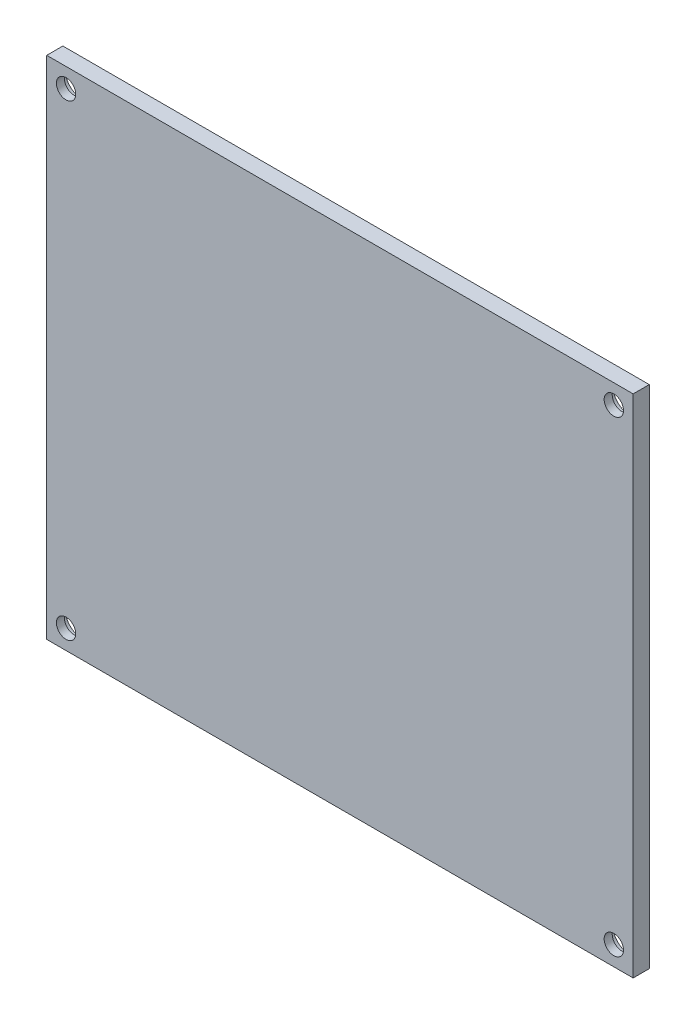
from build123d import *

# Parameters (mm, degrees)
SKETCH1_W                                        = 72.8
SKETCH1_H                                        = 62.8
BOSS_EXTRUDE1_DEPTH                              = 2
CBORE_FOR_M2_PAN_HEAD_MACHINE_SCREW1_D           = 2.4
CBORE_FOR_M2_PAN_HEAD_MACHINE_SCREW1_DEPTH       = 6
CBORE_FOR_M2_PAN_HEAD_MACHINE_SCREW1_CBORE_D     = 4.25
CBORE_FOR_M2_PAN_HEAD_MACHINE_SCREW1_CBORE_DEPTH = 1
CBORE_FOR_M2_PAN_HEAD_MACHINE_SCREW1_TIP         = 0.721032743


with BuildPart() as part:
    # Sketch1 → Boss-Extrude1 (new body)
    with BuildSketch(Plane.XY):
        with Locations((95.591153219, 5.136127214)):
            Rectangle(SKETCH1_W, SKETCH1_H)
    extrude(amount=BOSS_EXTRUDE1_DEPTH)

    # CBORE for M2 Pan Head Machine Screw1
    with Locations(Plane(origin=(0, 0, 0), x_dir=(-1, 0, 0), z_dir=(0, 0, -1))):
        with Locations((-129.591153219, 34.136127214), (-61.591153219, 34.136127214), (-61.591153219, -23.863872786), (-129.591153219, -23.863872786)):
            CounterBoreHole(CBORE_FOR_M2_PAN_HEAD_MACHINE_SCREW1_D / 2, CBORE_FOR_M2_PAN_HEAD_MACHINE_SCREW1_CBORE_D / 2, CBORE_FOR_M2_PAN_HEAD_MACHINE_SCREW1_CBORE_DEPTH, depth=CBORE_FOR_M2_PAN_HEAD_MACHINE_SCREW1_DEPTH)
            with Locations((0, 0, -(CBORE_FOR_M2_PAN_HEAD_MACHINE_SCREW1_DEPTH + CBORE_FOR_M2_PAN_HEAD_MACHINE_SCREW1_TIP / 2))):  # 118° drill point
                Cone(0, CBORE_FOR_M2_PAN_HEAD_MACHINE_SCREW1_D / 2, CBORE_FOR_M2_PAN_HEAD_MACHINE_SCREW1_TIP, mode=Mode.SUBTRACT)


solid = part.part
